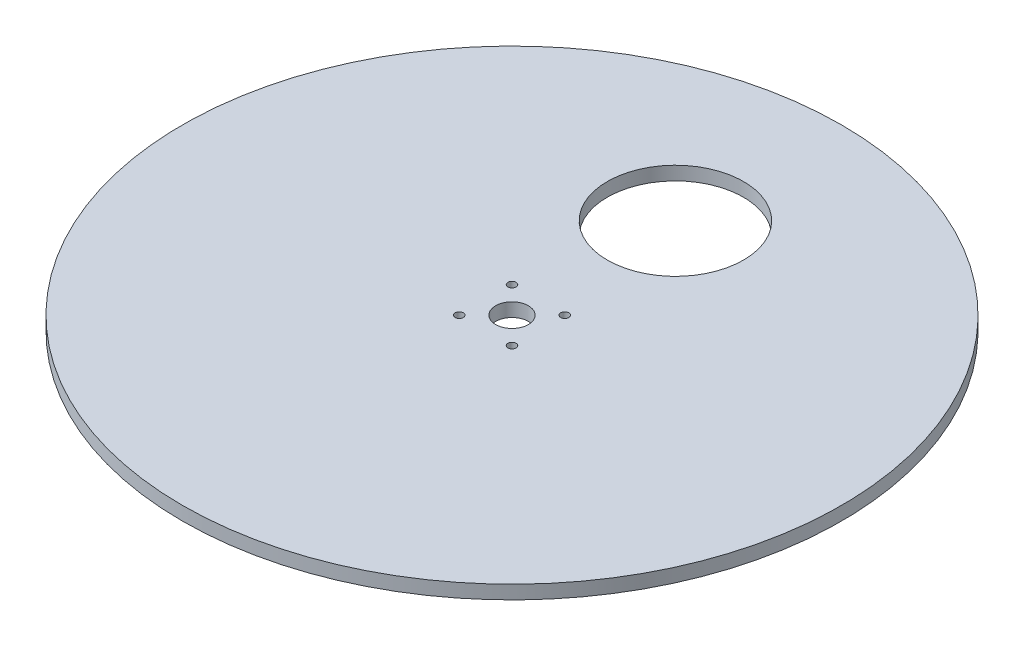
from build123d import *

# Parameters (mm, degrees)
SKETCH1_R           = 121
SKETCH1_R_2         = 6
SKETCH1_R_3         = 25
SKETCH1_R_4         = 1.5
BOSS_EXTRUDE1_DEPTH = 5


with BuildPart() as part:
    # Sketch1 → Boss-Extrude1 (new body)
    with BuildSketch(Plane(origin=(0, 0, 0), x_dir=(1, 0, 0), z_dir=(0, 1, 0))):
        Circle(SKETCH1_R)
        Circle(SKETCH1_R_2, mode=Mode.SUBTRACT)
        with Locations((0, 60)):
            Circle(SKETCH1_R_3, mode=Mode.SUBTRACT)
        with Locations((9.686203462, 9.686203462)):
            Circle(SKETCH1_R_4, mode=Mode.SUBTRACT)
        with Locations((-9.686203462, 9.686203462)):
            Circle(SKETCH1_R_4, mode=Mode.SUBTRACT)
        with Locations((-9.686203462, -9.686203462)):
            Circle(SKETCH1_R_4, mode=Mode.SUBTRACT)
        with Locations((9.686203462, -9.686203462)):
            Circle(SKETCH1_R_4, mode=Mode.SUBTRACT)
    extrude(amount=BOSS_EXTRUDE1_DEPTH)


solid = part.part
